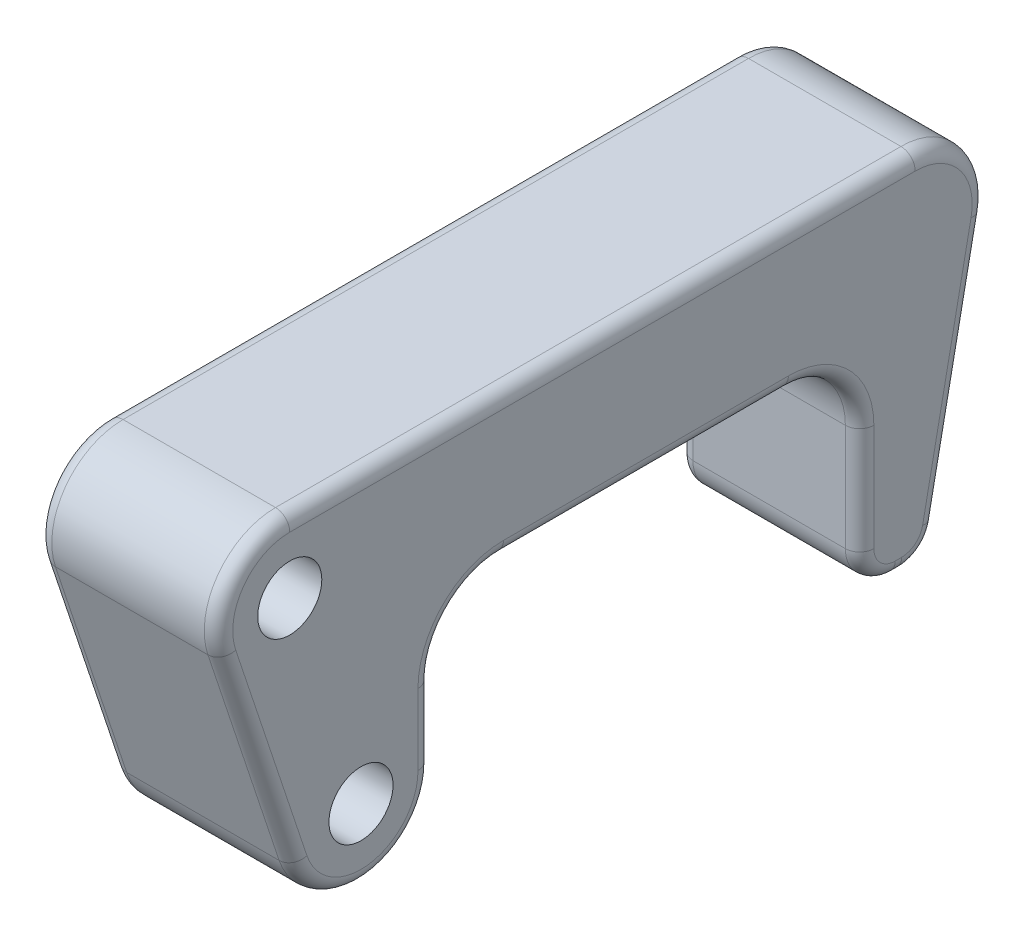
from build123d import *

# Parameters (mm, degrees)
SKETCH1_R           = 2.25
BOSS_EXTRUDE1_DEPTH = 12.7
FILLET1_R           = 5
FILLET2_R           = 2.5
FILLET3_R           = 1


with BuildPart() as part:
    # Sketch1 → Boss-Extrude1 (new body)
    with BuildSketch(Plane(origin=(0, 0, 0), x_dir=(0, 0, -1), z_dir=(1, 0, 0))):
        with BuildLine():
            Line((50, 5), (0, 5))
            ThreePointArc((0, 5), (-4.056210926, 2.923551423), (-4.74341649, -1.58113883))
            Line((-4.74341649, -1.58113883), (0.25658351, -16.58113883))
            ThreePointArc((0.25658351, -16.58113883), (5.800911215, -19.935437288), (10, -15))
            Line((10, -15), (10, -5))
            Line((10, -5), (40, -5))
            Line((40, -5), (40, -20))
            Line((40, -20), (45, -20))
            Line((45, -20), (50, 5))
        make_face()
        Circle(SKETCH1_R, mode=Mode.SUBTRACT)
        with Locations((5, -15)):
            Circle(SKETCH1_R, mode=Mode.SUBTRACT)
    extrude(amount=BOSS_EXTRUDE1_DEPTH)

    # Fillet1
    fillet1_edges = [part.edges().sort_by_distance(p)[0] for p in [
        (6.35, -5, -40),
        (6.35, 5, -50),
        (6.35, -5, -10),
    ]]
    fillet(fillet1_edges, radius=FILLET1_R)

    # Fillet2
    fillet2_edges = [part.edges().sort_by_distance(p)[0] for p in [
        (6.35, -20, -45),
        (6.35, -20, -40),
    ]]
    fillet(fillet2_edges, radius=FILLET2_R)

    # Fillet3
    fillet3_edges = [part.edges().sort_by_distance(p)[0] for p in [
        (0, -6.464466094, -38.535533906),
        (0, -13.75, -40),
        (0, -19.267766953, -40.732233047),
        (0, -20, -42.725245122),
        (0, -19.433355353, -44.535462507),
        (0, -9.485435507, -47.102912899),
        (0, 3.169944528, -47.767691193),
        (0, 5, -21.950490243),
        (0, 2.923551423, 4.056210926),
        (0, -9.08113883, 2.24341649),
        (0, -19.935437288, -5.800911215),
        (0, -12.5, -10),
        (0, -6.464466094, -11.464466094),
        (12.7, -6.464466094, -38.535533906),
        (12.7, -13.75, -40),
        (12.7, -19.267766953, -40.732233047),
        (12.7, -20, -42.725245122),
        (12.7, -19.433355353, -44.535462507),
        (12.7, -9.485435507, -47.102912899),
        (12.7, 3.169944528, -47.767691193),
        (12.7, 5, -21.950490243),
        (12.7, 2.923551423, 4.056210926),
        (12.7, -9.08113883, 2.24341649),
        (12.7, -19.935437288, -5.800911215),
        (12.7, -12.5, -10),
        (12.7, -6.464466094, -11.464466094),
        (0, -5, -25),
        (12.7, -5, -25),
    ]]
    fillet(fillet3_edges, radius=FILLET3_R)


solid = part.part
